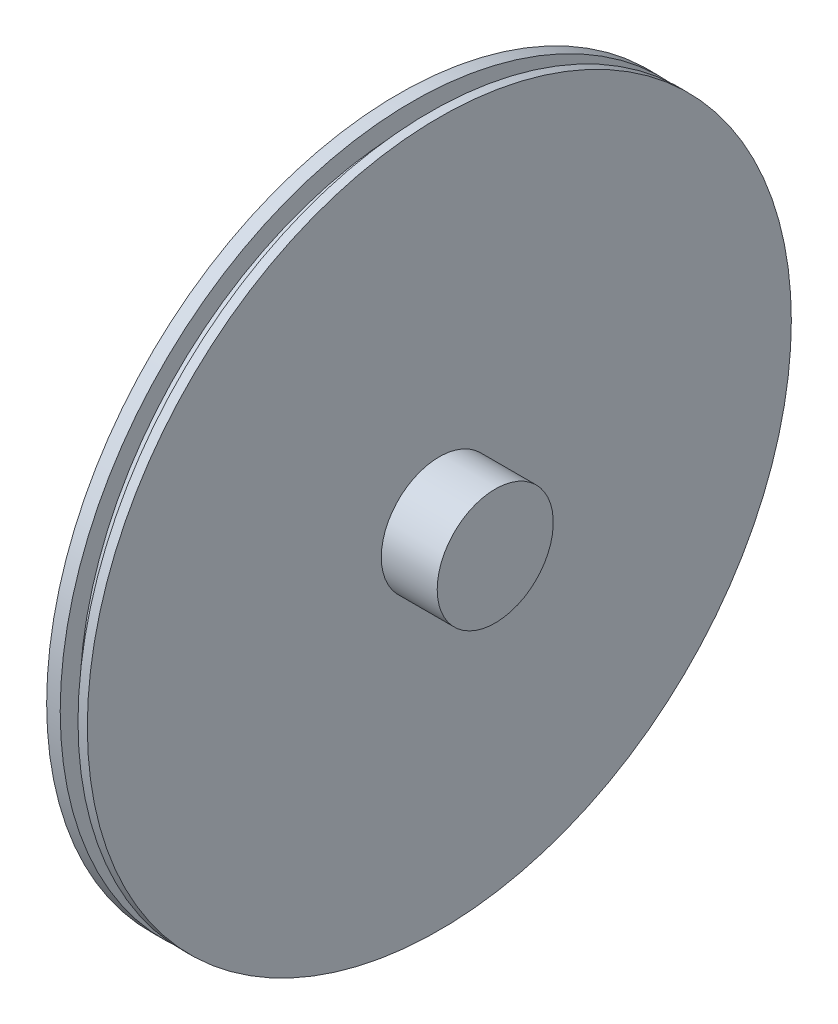
from build123d import *


with BuildPart() as part:
    # Szkic1 → Obrót1 (revolve)
    with BuildSketch(Plane.XY):
        Polygon((0, 0), (21.565580217, 0), (21.565580217, 16.414150943), (5.755941014, 16.414150943), (5.755941014, 99.563207547), (3.120091958, 99.563207547), (3.120091958, 94.051886792), (-1.911983514, 94.051886792), (-1.911983514, 99.563207547), (-5.745945778, 99.563207547), (-5.745945778, 0), align=None)
    revolve(axis=Axis((0, 0, 0), (1, 0, 0)))


solid = part.part
